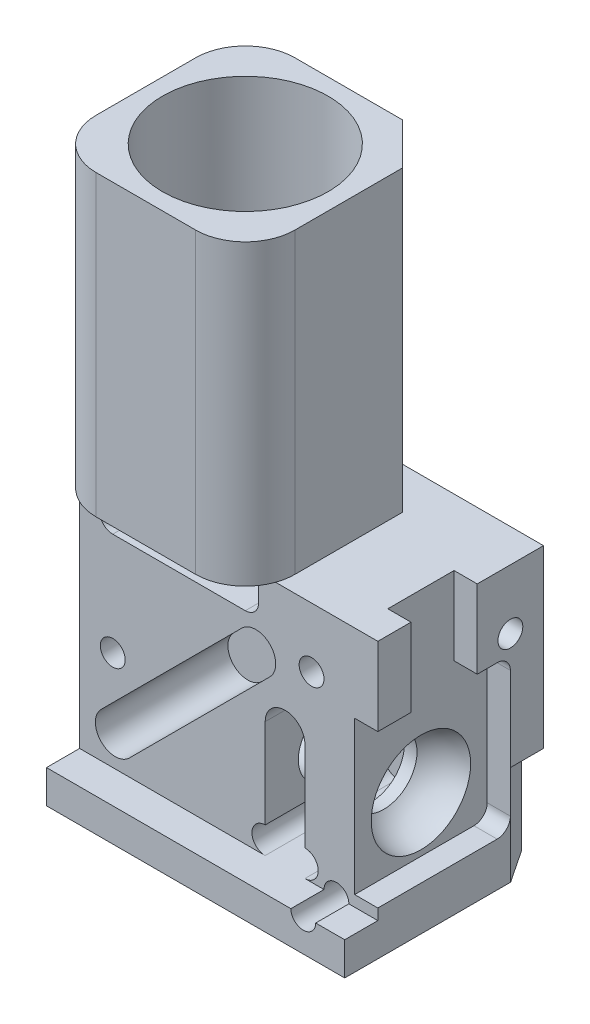
from build123d import *

# Parameters (mm, degrees)
SKETCH1_W                   = 9
SKETCH1_H                   = 6
MAIN_BODY_EXT_DEPTH         = 8.3
EMISSION_PATH_EXT_DEPTH     = 9
SKETCH3_R                   = 1.25
EMISSION_AND_GRIN_CUT_DEPTH = 19.125672401
SKETCH4_R                   = 1
DRUM_LENS_CUT_DEPTH         = 7
SKETCH5_W                   = 9
SKETCH5_H                   = 7.3
FILTERSET_CUT1_DEPTH        = 1
FILTERSET_CUT2_DEPTH        = 4
SKETCH10_R                  = 2.5
EMISSION_LENS_CUT_DEPTH     = 8.5
SKETCH15_R                  = 0.795
MAGNETS_CUT_DEPTH           = 0.9
SCREW_HOLES_CUT_DEPTH       = 19.561788707
SCREW_HOLES_CUT_DEPTH_BACK  = 3
SKETCH18_R                  = 0.375
EXTERNAL_FILLET_1_R         = 1.5
CUT_EXTRUDE8_DEPTH          = 12.545128843
CUT_EXTRUDE8_DEPTH_BACK     = 4
SKETCH28_R                  = 1.5
CUT_EXTRUDE9_DEPTH          = 3
CUT_EXTRUDE10_DEPTH         = 0.7
SKETCH29_R                  = 0.375
CUT_EXTRUDE11_DEPTH         = 2.5
SKETCH32_W                  = 2
SKETCH32_H                  = 2.36
CUT_EXTRUDE14_DEPTH         = 0.7
CUT_EXTRUDE16_DEPTH         = 9
CUT_EXTRUDE17_REACH         = 12.329
SKETCH37_R                  = 2


with BuildPart() as part:
    # Sketch1 → Main Body Ext (new body)
    with BuildSketch(Plane(origin=(0, 0, 0), x_dir=(1, 0, 0), z_dir=(0, 1, 0))):
        Rectangle(SKETCH1_W, SKETCH1_H)
    extrude(amount=MAIN_BODY_EXT_DEPTH)

    # Sketch8 → Emission Path Ext (add)
    with BuildSketch(Plane(origin=(0, 8.3, 0), x_dir=(1, 0, 0), z_dir=(0, 1, 0))):
        Polygon((0.25, 3), (1.5, 1.75), (1.5, -3), (-4.5, -3), (-4.5, 3), align=None)
    extrude(amount=EMISSION_PATH_EXT_DEPTH)

    # Sketch3 → Emission and Grin Cut (cut, through all)
    with BuildSketch(Plane.XZ):
        with Locations(Location((-1.5, 0, 0), (0, 0, 270))):
            Circle(SKETCH3_R)
    extrude(amount=-EMISSION_AND_GRIN_CUT_DEPTH, mode=Mode.SUBTRACT)

    # Sketch4 → Drum Lens Cut (cut)
    with BuildSketch(Plane(origin=(4.5, 0, 0), x_dir=(0, 0, -1), z_dir=(1, 0, 0))):
        with Locations((0, 3)):
            Circle(SKETCH4_R)
    extrude(amount=-DRUM_LENS_CUT_DEPTH, mode=Mode.SUBTRACT)

    # Sketch5 → FilterSet Cut1 (cut)
    with BuildSketch(Plane.XY.offset(3)):
        with Locations((0, 4.65)):
            Rectangle(SKETCH5_W, SKETCH5_H)
    extrude(amount=-FILTERSET_CUT1_DEPTH, mode=Mode.SUBTRACT)

    # Sketch6 → FilterSet Cut2 (cut)
    with BuildSketch(Plane.XY.offset(2)):
        with BuildLine():
            Line((2.3, 4.5), (2.3, 1.8))
            ThreePointArc((2.3, 1.8), (2.7, 1.4), (2.3, 1))
            Line((2.3, 1), (1.1, 1))
            ThreePointArc((1.1, 1), (0.7, 1.4), (1.1, 1.8))
            Line((1.1, 1.8), (1.1, 4.5))
            ThreePointArc((1.1, 4.5), (1.7, 5.1), (2.3, 4.5))
        make_face()
        with BuildLine():
            Line((-3.9, 7.9), (-3.9, 7.5))
            ThreePointArc((-3.9, 7.5), (-3.782842712, 7.217157288), (-3.5, 7.1))
            Line((-3.5, 7.1), (0.5, 7.1))
            ThreePointArc((0.5, 7.1), (0.782842712, 7.217157288), (0.9, 7.5))
            Line((0.9, 7.5), (0.9, 7.9))
            ThreePointArc((0.9, 7.9), (0.782842712, 8.182842712), (0.5, 8.3))
            Line((0.5, 8.3), (-3.5, 8.3))
            ThreePointArc((-3.5, 8.3), (-3.782842712, 8.182842712), (-3.9, 7.9))
        make_face()
        with BuildLine():
            Line((0.39411255, 6.591168825), (-3.848528137, 2.348528137))
            ThreePointArc((-3.848528137, 2.348528137), (-3.848528137, 1.5), (-3, 1.5))
            Line((-3, 1.5), (1.242640687, 5.742640687))
            ThreePointArc((1.242640687, 5.742640687), (1.242640687, 6.591168825), (0.39411255, 6.591168825))
        make_face()
    extrude(amount=-FILTERSET_CUT2_DEPTH, mode=Mode.SUBTRACT)

    # Sketch10 → Emission Lens Cut (cut)
    with BuildSketch(Plane(origin=(0, 17.3, 0), x_dir=(1, 0, 0), z_dir=(0, 1, 0))):
        with Locations(Location((-1.5, 0, 0), (0, 0, 270))):
            Circle(SKETCH10_R)
    extrude(amount=-EMISSION_LENS_CUT_DEPTH, mode=Mode.SUBTRACT)

    # Sketch15 → Magnets Cut (cut)
    with BuildSketch(Plane.XZ):
        with Locations(Location((-3.25, -1.875, 0), (0, 0, 270))):
            Circle(SKETCH15_R)
        with Locations(Location((-3.25, 1.875, 0), (0, 0, 270))):
            Circle(SKETCH15_R)
        with Locations(Location((1.5, 0, 0), (0, 0, 270))):
            Circle(SKETCH15_R)
    extrude(amount=-MAGNETS_CUT_DEPTH, mode=Mode.SUBTRACT)

    # Sketch18 → Screw Holes Cut (cut, two sides: drawn at the far end of the back side and taken through both)
    with BuildSketch(Plane.XY.offset(2).offset(-SCREW_HOLES_CUT_DEPTH_BACK)):
        with Locations(Location((-3.5, 4, 0), (0, 0, 180))):
            Circle(SKETCH18_R)
        with Locations(Location((2.5, 6.5, 0), (0, 0, 180))):
            Circle(SKETCH18_R)
        with Locations((3.25, 1)):
            Circle(SKETCH18_R)
    extrude(amount=SCREW_HOLES_CUT_DEPTH + SCREW_HOLES_CUT_DEPTH_BACK, mode=Mode.SUBTRACT)

    # External Fillet 1
    # the kernel refuses this fillet: 1.5 mm, written as the material it takes off along each edge
    with BuildSketch(Plane(origin=(1.5, 8.3, 3), x_dir=(0, 0, -1), z_dir=(0, 1, 0))) as external_fillet_1_piece_1:
        with BuildLine():
            CenterArc((EXTERNAL_FILLET_1_R, EXTERNAL_FILLET_1_R), EXTERNAL_FILLET_1_R, 180, 90)
            Line((0, EXTERNAL_FILLET_1_R), (0, 0))
            Line((0, 0), (EXTERNAL_FILLET_1_R, 0))
        make_face()
    extrude(amount=12.75, mode=Mode.SUBTRACT)
    with BuildSketch(Plane(origin=(-4.5, -3.75, -3), x_dir=(1, 0, 0), z_dir=(0, 1, 0))) as external_fillet_1_piece_2:
        with BuildLine():
            CenterArc((EXTERNAL_FILLET_1_R, -EXTERNAL_FILLET_1_R), EXTERNAL_FILLET_1_R, 90, 90)
            Line((0, -EXTERNAL_FILLET_1_R), (0, 0))
            Line((0, 0), (EXTERNAL_FILLET_1_R, 0))
        make_face()
    extrude(amount=24.8, mode=Mode.SUBTRACT)

    # Sketch28 → Cut-Extrude8 (cut, two sides: drawn at the far end of the back side and taken through both)
    with BuildSketch(Plane(origin=(0, 7.1, 0), x_dir=(1, 0, 0), z_dir=(0, 1, 0)).offset(-CUT_EXTRUDE8_DEPTH_BACK)):
        with Locations(Location((-1.5, 0, 0), (0, 0, 180))):
            Circle(SKETCH28_R)
    extrude(amount=CUT_EXTRUDE8_DEPTH + CUT_EXTRUDE8_DEPTH_BACK, mode=Mode.SUBTRACT)

    # Sketch14 → Cut-Extrude9 (cut)
    with BuildSketch(Plane.XZ):
        Polygon((4.5, -3), (4.5, -2.006698359), (3.837798906, -3), align=None)
    extrude(amount=-CUT_EXTRUDE9_DEPTH, mode=Mode.SUBTRACT)

    # Sketch12 → Cut-Extrude10 (cut)
    with BuildSketch(Plane(origin=(4.5, 0, 0), x_dir=(0, 0, -1), z_dir=(1, 0, 0))):
        with BuildLine():
            Line((1.6, 5.94), (-1.6, 5.94))
            Line((-1.6, 5.94), (-2, 5.94))
            Line((-2, 5.94), (-2, 1.33))
            Line((-2, 1.33), (1.6, 1.33))
            ThreePointArc((1.6, 1.33), (1.882842712, 1.447157288), (2, 1.73))
            Line((2, 1.73), (2, 5.54))
            ThreePointArc((2, 5.54), (1.882842712, 5.822842712), (1.6, 5.94))
        make_face()
    extrude(amount=-CUT_EXTRUDE10_DEPTH, mode=Mode.SUBTRACT)

    # Sketch29 → Cut-Extrude11 (cut)
    with BuildSketch(Plane(origin=(4.5, 0, 0), x_dir=(0, 0, -1), z_dir=(1, 0, 0))):
        with Locations((2, 6.5)):
            Circle(SKETCH29_R)
    extrude(amount=-CUT_EXTRUDE11_DEPTH, mode=Mode.SUBTRACT)

    # Sketch32 → Cut-Extrude14 (cut)
    with BuildSketch(Plane(origin=(4.5, 0, 0), x_dir=(0, 0, -1), z_dir=(1, 0, 0))):
        with Locations((0, 7.12)):
            Rectangle(SKETCH32_W, SKETCH32_H)
    extrude(amount=-CUT_EXTRUDE14_DEPTH, mode=Mode.SUBTRACT)

    # Sketch33 → Cut-Revolve1 (revolve, cut)
    with BuildSketch(Plane.XY, mode=Mode.PRIVATE) as cut_revolve1_sk:
        with BuildLine():
            Line((3.8, 3), (2.3, 3))
            ThreePointArc((2.3, 3), (2.739339828, 4.060660172), (3.8, 4.5))
            Line((3.8, 4.5), (3.8, 3))
        make_face()
    revolve(cut_revolve1_sk.sketch.rotate(Axis((3.8, 3, 0), (-1, 0, 0)), 90), axis=Axis((3.8, 3, 0), (-1, 0, 0)), mode=Mode.SUBTRACT)

    # Sketch36 → Cut-Extrude16 (cut)
    with BuildSketch(Plane(origin=(0, 17.3, 0), x_dir=(1, 0, 0), z_dir=(0, 1, 0))):
        with BuildLine():
            Line((-4.5, -1.5), (-4.5, -3))
            Line((-4.5, -3), (-3, -3))
            ThreePointArc((-3, -3), (-4.060660172, -2.560660172), (-4.5, -1.5))
        make_face()
    extrude(amount=-CUT_EXTRUDE16_DEPTH, mode=Mode.SUBTRACT)

    # Sketch37 → Cut-Extrude17 (cut, up to next)
    with BuildSketch(Plane(origin=(0, 8.8, 0), x_dir=(1, 0, 0), z_dir=(0, 1, 0)), mode=Mode.PRIVATE) as cut_extrude17_sk1:
        with Locations(Location((-1.5, 0, 0), (0, 0, 180))):
            Circle(SKETCH37_R)
    cut_extrude17_tool1 = extrude(cut_extrude17_sk1.sketch, amount=-CUT_EXTRUDE17_REACH, mode=Mode.PRIVATE) & part.part
    add(cut_extrude17_tool1.solids().sort_by_distance((-1.5, 8.8, 0))[0], mode=Mode.SUBTRACT)


solid = part.part
